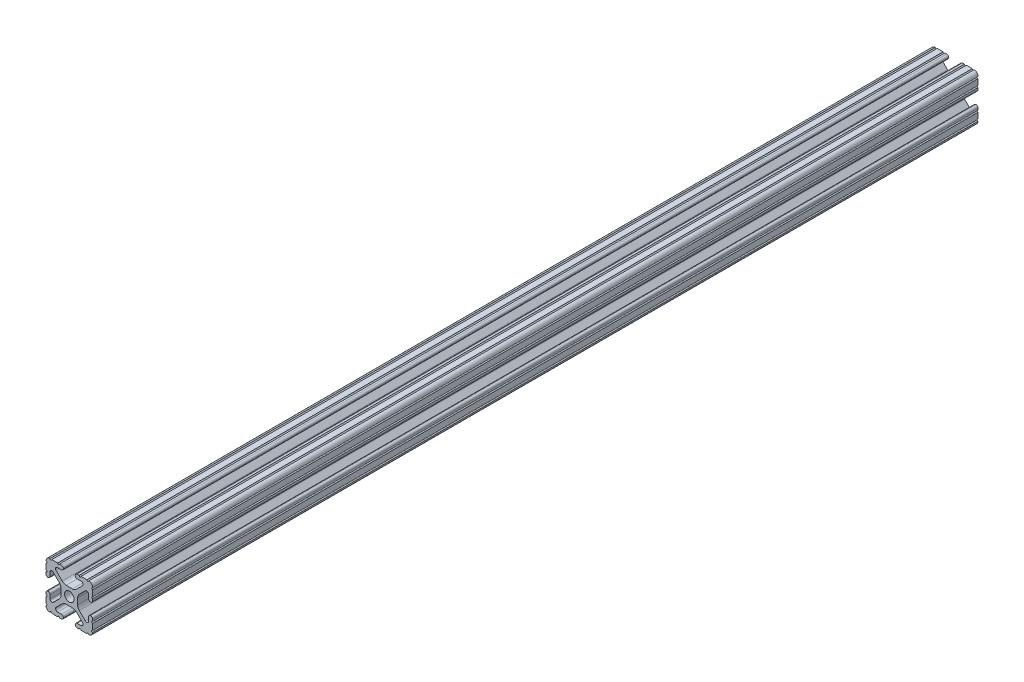
from build123d import *

# Parameters (mm, degrees)
SKETCH1_R           = 2.6035
BOSS_EXTRUDE1_DEPTH = 304.8
SKETCH2_R           = 22.453588809
CUT_EXTRUDE1_DEPTH  = 127


with BuildPart() as part:
    # Sketch1 → Boss-Extrude1 (new, symmetric)
    with BuildSketch(Plane.XY):
        with BuildLine():
            Line((-7.179650497, -8.645192506), (-3.952270251, -5.423690499))
            ThreePointArc((-3.952270251, -5.423690499), (-2.922936451, -4.736929036), (-1.709253557, -4.4958))
            Line((-1.709253557, -4.4958), (1.709253557, -4.4958))
            ThreePointArc((1.709253557, -4.4958), (2.922936451, -4.736929036), (3.952270251, -5.423690499))
            Line((3.952270251, -5.423690499), (7.179650497, -8.645192506))
            ThreePointArc((7.179650497, -8.645192506), (7.41473083, -9.822813117), (6.416408329, -10.4902))
            Line((6.416408329, -10.4902), (4.287512407, -10.4902))
            ThreePointArc((4.287512407, -10.4902), (3.54574862, -10.79744862), (3.2385, -11.539212407))
            Line((3.2385, -11.539212407), (3.2385, -11.650987593))
            ThreePointArc((3.2385, -11.650987593), (3.54574862, -12.39275138), (4.287512407, -12.7))
            Line((4.287512407, -12.7), (5.317126718, -12.7))
            ThreePointArc((5.317126718, -12.7), (5.825126718, -12.192), (6.333126718, -12.7))
            Line((6.333126718, -12.7), (9.550443118, -12.7))
            ThreePointArc((9.550443118, -12.7), (10.058366869, -12.192000006), (10.566443095, -12.699847501))
            ThreePointArc((10.566443095, -12.699847501), (12.082537762, -12.08250727), (12.699846982, -10.566399977))
            ThreePointArc((12.699846982, -10.566399977), (12.192000006, -10.058323491), (12.7, -9.5504))
            Line((12.7, -9.5504), (12.7, -6.3330836))
            ThreePointArc((12.7, -6.3330836), (12.192, -5.8250836), (12.7, -5.3170836))
            Line((12.7, -5.3170836), (12.7, -4.287469289))
            ThreePointArc((12.7, -4.287469289), (12.39275138, -3.545705502), (11.650987593, -3.238456882))
            Line((11.650987593, -3.238456882), (11.539212407, -3.238456882))
            ThreePointArc((11.539212407, -3.238456882), (10.79744862, -3.545705502), (10.4902, -4.287469289))
            Line((10.4902, -4.287469289), (10.4902, -6.402089023))
            ThreePointArc((10.4902, -6.402089023), (9.856505071, -7.351067942), (8.737131347, -7.129408934))
            Line((8.737131347, -7.129408934), (5.441005833, -3.840816462))
            ThreePointArc((5.441005833, -3.840816462), (4.750877967, -2.809883091), (4.5085, -1.593185507))
            Line((4.5085, -1.593185507), (4.5085, 1.593185507))
            ThreePointArc((4.5085, 1.593185507), (4.750877967, 2.809883091), (5.441005833, 3.840816462))
            Line((5.441005833, 3.840816462), (8.737131347, 7.129408934))
            ThreePointArc((8.737131347, 7.129408934), (9.856505071, 7.351067942), (10.4902, 6.402089023))
            Line((10.4902, 6.402089023), (10.4902, 4.287469289))
            ThreePointArc((10.4902, 4.287469289), (10.79744862, 3.545705502), (11.539212407, 3.238456882))
            Line((11.539212407, 3.238456882), (11.650987593, 3.238456882))
            ThreePointArc((11.650987593, 3.238456882), (12.39275138, 3.545705502), (12.7, 4.287469289))
            Line((12.7, 4.287469289), (12.7, 5.3170836))
            ThreePointArc((12.7, 5.3170836), (12.192, 5.8250836), (12.7, 6.3330836))
            Line((12.7, 6.3330836), (12.7, 9.5504))
            ThreePointArc((12.7, 9.5504), (12.192000006, 10.058323491), (12.699846982, 10.566399977))
            ThreePointArc((12.699846982, 10.566399977), (12.082537762, 12.08250727), (10.566443095, 12.699847501))
            ThreePointArc((10.566443095, 12.699847501), (10.058366869, 12.192000006), (9.550443118, 12.7))
            Line((9.550443118, 12.7), (6.333126718, 12.7))
            ThreePointArc((6.333126718, 12.7), (5.825126718, 12.192), (5.317126718, 12.7))
            Line((5.317126718, 12.7), (4.287512407, 12.7))
            ThreePointArc((4.287512407, 12.7), (3.54574862, 12.39275138), (3.2385, 11.650987593))
            Line((3.2385, 11.650987593), (3.2385, 11.539212407))
            ThreePointArc((3.2385, 11.539212407), (3.54574862, 10.79744862), (4.287512407, 10.4902))
            Line((4.287512407, 10.4902), (6.476788598, 10.4902))
            ThreePointArc((6.476788598, 10.4902), (7.432222385, 9.85140422), (7.207036008, 8.724370562))
            Line((7.207036008, 8.724370562), (3.898272566, 5.423169045))
            ThreePointArc((3.898272566, 5.423169045), (2.869120213, 4.736787962), (1.655778399, 4.4958))
            Line((1.655778399, 4.4958), (-1.655778399, 4.4958))
            ThreePointArc((-1.655778399, 4.4958), (-2.869120213, 4.736787962), (-3.898272566, 5.423169045))
            Line((-3.898272566, 5.423169045), (-7.207036008, 8.724370562))
            ThreePointArc((-7.207036008, 8.724370562), (-7.432222385, 9.85140422), (-6.476788598, 10.4902))
            Line((-6.476788598, 10.4902), (-4.287512407, 10.4902))
            ThreePointArc((-4.287512407, 10.4902), (-3.54574862, 10.79744862), (-3.2385, 11.539212407))
            Line((-3.2385, 11.539212407), (-3.2385, 11.650987593))
            ThreePointArc((-3.2385, 11.650987593), (-3.54574862, 12.39275138), (-4.287512407, 12.7))
            Line((-4.287512407, 12.7), (-5.317126718, 12.7))
            ThreePointArc((-5.317126718, 12.7), (-5.825126718, 12.192), (-6.333126718, 12.7))
            Line((-6.333126718, 12.7), (-9.550443118, 12.7))
            ThreePointArc((-9.550443118, 12.7), (-10.058366869, 12.192000006), (-10.566443095, 12.699847501))
            ThreePointArc((-10.566443095, 12.699847501), (-12.082537762, 12.08250727), (-12.699846982, 10.566399977))
            ThreePointArc((-12.699846982, 10.566399977), (-12.192000006, 10.058323491), (-12.7, 9.5504))
            Line((-12.7, 9.5504), (-12.7, 6.3330836))
            ThreePointArc((-12.7, 6.3330836), (-12.192, 5.8250836), (-12.7, 5.3170836))
            Line((-12.7, 5.3170836), (-12.7, 4.287469289))
            ThreePointArc((-12.7, 4.287469289), (-12.39275138, 3.545705502), (-11.650987593, 3.238456882))
            Line((-11.650987593, 3.238456882), (-11.539212407, 3.238456882))
            ThreePointArc((-11.539212407, 3.238456882), (-10.79744862, 3.545705502), (-10.4902, 4.287469289))
            Line((-10.4902, 4.287469289), (-10.4902, 6.402089023))
            ThreePointArc((-10.4902, 6.402089023), (-9.856505071, 7.351067942), (-8.737131347, 7.129408934))
            Line((-8.737131347, 7.129408934), (-5.441005833, 3.840816462))
            ThreePointArc((-5.441005833, 3.840816462), (-4.750877967, 2.809883091), (-4.5085, 1.593185507))
            Line((-4.5085, 1.593185507), (-4.5085, -1.593185507))
            ThreePointArc((-4.5085, -1.593185507), (-4.750877967, -2.809883091), (-5.441005833, -3.840816462))
            Line((-5.441005833, -3.840816462), (-8.737131347, -7.129408934))
            ThreePointArc((-8.737131347, -7.129408934), (-9.856505071, -7.351067942), (-10.4902, -6.402089023))
            Line((-10.4902, -6.402089023), (-10.4902, -4.287469289))
            ThreePointArc((-10.4902, -4.287469289), (-10.79744862, -3.545705502), (-11.539212407, -3.238456882))
            Line((-11.539212407, -3.238456882), (-11.650987593, -3.238456882))
            ThreePointArc((-11.650987593, -3.238456882), (-12.39275138, -3.545705502), (-12.7, -4.287469289))
            Line((-12.7, -4.287469289), (-12.7, -5.3170836))
            ThreePointArc((-12.7, -5.3170836), (-12.192, -5.8250836), (-12.7, -6.3330836))
            Line((-12.7, -6.3330836), (-12.7, -9.5504))
            ThreePointArc((-12.7, -9.5504), (-12.192000006, -10.058323491), (-12.699846982, -10.566399977))
            ThreePointArc((-12.699846982, -10.566399977), (-12.082537762, -12.08250727), (-10.566443095, -12.699847501))
            ThreePointArc((-10.566443095, -12.699847501), (-10.058366869, -12.192000006), (-9.550443118, -12.7))
            Line((-9.550443118, -12.7), (-6.333126718, -12.7))
            ThreePointArc((-6.333126718, -12.7), (-5.825126718, -12.192), (-5.317126718, -12.7))
            Line((-5.317126718, -12.7), (-4.287512407, -12.7))
            ThreePointArc((-4.287512407, -12.7), (-3.54574862, -12.39275138), (-3.2385, -11.650987593))
            Line((-3.2385, -11.650987593), (-3.2385, -11.539212407))
            ThreePointArc((-3.2385, -11.539212407), (-3.54574862, -10.79744862), (-4.287512407, -10.4902))
            Line((-4.287512407, -10.4902), (-6.416408329, -10.4902))
            ThreePointArc((-6.416408329, -10.4902), (-7.41473083, -9.822813117), (-7.179650497, -8.645192506))
        make_face()
        Circle(SKETCH1_R, mode=Mode.SUBTRACT)
    extrude(amount=BOSS_EXTRUDE1_DEPTH, both=True)

    # Sketch2 → Cut-Extrude1 (cut)
    with BuildSketch(Plane(origin=(0, 0, -304.8), x_dir=(-1, 0, 0), z_dir=(0, 0, -1))):
        Circle(SKETCH2_R)
    extrude(amount=-CUT_EXTRUDE1_DEPTH, mode=Mode.SUBTRACT)


solid = part.part
